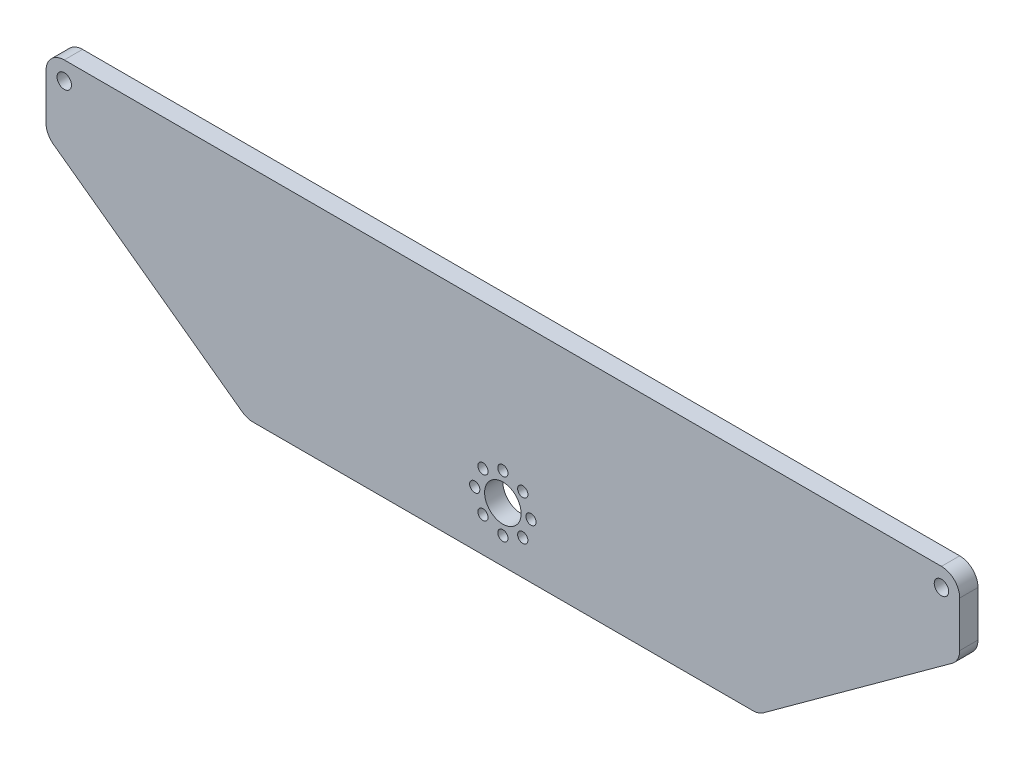
from build123d import *

# Parameters (mm, degrees)
SKETCH1_W           = 317.5
SKETCH1_H           = 76.2
SKETCH1_R           = 6.35
SKETCH1_R_2         = 2.50825
BOSS_EXTRUDE1_DEPTH = 6.35
CUT_EXTRUDE1_DEPTH  = 6.35
FILLET1_R           = 6.35
SKETCH3_R           = 1.778
CUT_EXTRUDE2_DEPTH  = 6.35
CIRPATTERN1_COUNT   = 8


with BuildPart() as part:
    # Sketch1 → Boss-Extrude1 (new body)
    with BuildSketch(Plane.XY):
        Rectangle(SKETCH1_W, SKETCH1_H)
        with Locations((0, -19.05)):
            Circle(SKETCH1_R, mode=Mode.SUBTRACT)
        with Locations((152.4, 31.75)):
            Circle(SKETCH1_R_2, mode=Mode.SUBTRACT)
        with Locations((-152.4, 31.75)):
            Circle(SKETCH1_R_2, mode=Mode.SUBTRACT)
    extrude(amount=BOSS_EXTRUDE1_DEPTH)

    # Sketch2 → Cut-Extrude1 (cut)
    with BuildSketch(Plane(origin=(0, 0, 0), x_dir=(-1, 0, 0), z_dir=(0, 0, -1))):
        Polygon((88.9, -38.1), (158.75, 12.7), (158.75, -38.1), align=None)
        Polygon((-158.75, -38.1), (-158.75, 12.7), (-88.9, -38.1), align=None)
    extrude(amount=-CUT_EXTRUDE1_DEPTH, mode=Mode.SUBTRACT)

    # Fillet1
    fillet1_edges = [part.edges().sort_by_distance(p)[0] for p in [
        (-158.75, 38.1, 3.175),
        (158.75, 12.7, 3.175),
        (-158.75, 12.7, 3.175),
        (-88.9, -38.1, 3.175),
        (88.9, -38.1, 3.175),
        (158.75, 38.1, 3.175),
    ]]
    fillet(fillet1_edges, radius=FILLET1_R)

    # Sketch3 → Cut-Extrude2 (cut)
    with BuildSketch(Plane(origin=(0, 0, 0), x_dir=(-1, 0, 0), z_dir=(0, 0, -1))):
        with Locations((0, -9.271)):
            Circle(SKETCH3_R)
    cut_extrude2 = extrude(amount=-CUT_EXTRUDE2_DEPTH, mode=Mode.SUBTRACT)

    # CirPattern1: Cut-Extrude2 ×8 about axis
    cirpattern1_axis = Axis((0, -19.05, 0), (0, 0, 1))
    for i in range(1, CIRPATTERN1_COUNT):
        add(cut_extrude2.rotate(cirpattern1_axis, i * 360 / CIRPATTERN1_COUNT), mode=Mode.SUBTRACT)


solid = part.part
